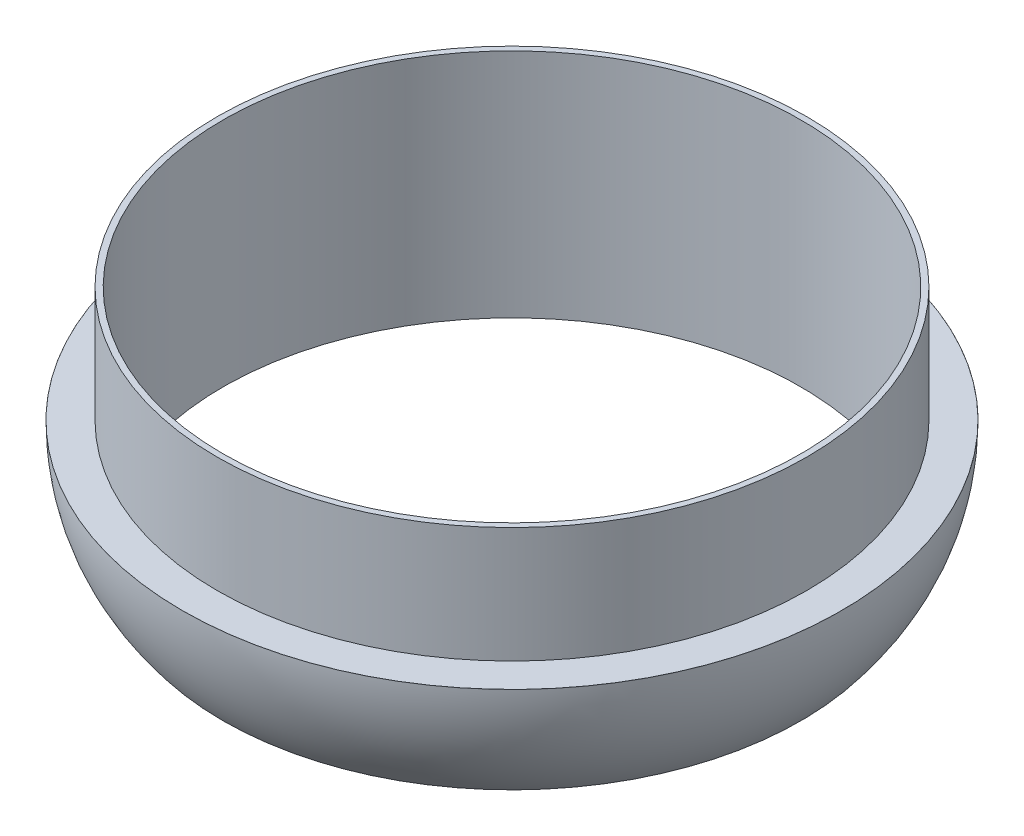
from build123d import *

# Parameters (mm, degrees)
SKETCH1_R           = 25.5
SKETCH1_R_2         = 25
BOSS_EXTRUDE2_DEPTH = 10
BOSS_EXTRUDE3_START = -10
SKETCH1_4_R         = 28.5
SKETCH1_4_R_2       = 25.5
SKETCH1_4_R_3       = 25
BOSS_EXTRUDE3_DEPTH = 10
FILLET1_R           = 16


with BuildPart() as part:
    # Sketch1 → Boss-Extrude2 (new body)
    with BuildSketch(Plane(origin=(0, 0, 0), x_dir=(1, 0, 0), z_dir=(0, 1, 0))):
        with Locations(Location((0, 0, 0), (0, 0, 270))):
            Circle(SKETCH1_R)
        with Locations(Location((0, 0, 0), (0, 0, 270))):
            Circle(SKETCH1_R_2, mode=Mode.SUBTRACT)
    extrude(amount=BOSS_EXTRUDE2_DEPTH)

    # Sketch1<4> → Boss-Extrude3 (add)
    # profile 1 of 2: a face of its own
    with BuildSketch(Plane(origin=(0, 0, 0), x_dir=(1, 0, 0), z_dir=(0, 1, 0)).offset(BOSS_EXTRUDE3_START)):
        with Locations(Location((0, 0, 0), (0, 0, 270))):
            Circle(SKETCH1_4_R)
        with Locations(Location((0, 0, 0), (0, 0, 270))):
            Circle(SKETCH1_4_R_2, mode=Mode.SUBTRACT)
    # profile 2 of 2: a face of its own
    with BuildSketch(Plane(origin=(0, 0, 0), x_dir=(1, 0, 0), z_dir=(0, 1, 0)).offset(BOSS_EXTRUDE3_START)):
        with Locations(Location((0, 0, 0), (0, 0, 270))):
            Circle(SKETCH1_4_R_2)
        with Locations(Location((0, 0, 0), (0, 0, 270))):
            Circle(SKETCH1_4_R_3, mode=Mode.SUBTRACT)
    extrude(amount=BOSS_EXTRUDE3_DEPTH)

    # Chamfer1: read off the stored shape, not the designer's step
    # Chamfer1 outline → Chamfer1 (revolve, cut)
    with BuildSketch(Plane.XY):
        Polygon((28.5, -6.5), (25, -10), (28.5, -10), align=None)
    revolve(axis=Axis((0, 0, 0), (0, 1, 0)), mode=Mode.SUBTRACT)

    # Fillet1
    # the kernel refuses this fillet: 16 mm, written as the material it takes off along each edge
    with BuildSketch(Plane(origin=(0, -6.5, 0), x_dir=(0, 0, 1), z_dir=(-1, 0, 0))) as fillet1_piece_1:
        with BuildLine():
            CenterArc((12.5, 6.487492178), FILLET1_R, 321.375167127, 38.624832873)
            Line((25, -3.5), (28.5, 0))
            Line((28.5, 0), (28.5, 6.487492178))
        make_face()
    revolve(axis=Axis((0, -6.5, 0), (0, 1, 0)), revolution_arc=90, mode=Mode.SUBTRACT)
    with BuildSketch(Plane(origin=(0, -6.5, 0), x_dir=(1, 0, 0), z_dir=(0, 0, 1))) as fillet1_piece_2:
        with BuildLine():
            CenterArc((12.5, 6.487492178), FILLET1_R, 321.375167127, 38.624832873)
            Line((25, -3.5), (28.5, 0))
            Line((28.5, 0), (28.5, 6.487492178))
        make_face()
    revolve(axis=Axis((0, -6.5, 0), (0, 1, 0)), revolution_arc=270, mode=Mode.SUBTRACT)


solid = part.part
